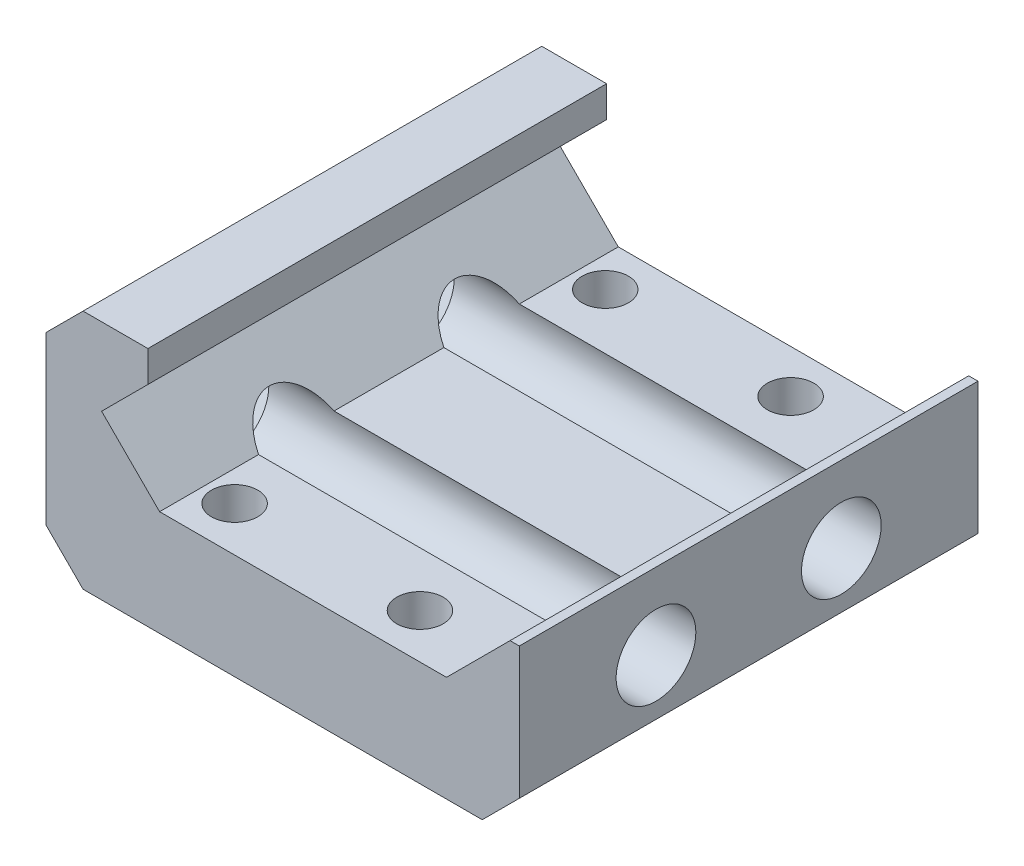
from build123d import *

# Parameters (mm, degrees)
DODANIE_WYCI_GNI_CIE3_DEPTH = 24.75
SZKIC3_R                    = 2.15
WYTNIJ_WYCI_GNI_CIE1_DEPTH  = 37.64214104
CUT_EXTRUDE1_DEPTH          = 35.618008319
CHAMFER1_SIZE               = 2
F_2_5_2_5_DIAMETER_HOLE1_D  = 2.5
CUT_EXTRUDE2_DEPTH          = 2.5


with BuildPart() as part:
    # Szkic1 → Dodanie-wyciągnięcie3 (new body)
    with BuildSketch(Plane.XY):
        Polygon((-3, 4.18), (2.5, 4.18), (2.5, 2.5), (0, 0), (3.13, -3.13), (18.61, -3.13), (22.54, 0.8), (22.54, -6.82), (20.54, -8.82), (-3, -8.82), align=None)
    extrude(amount=DODANIE_WYCI_GNI_CIE3_DEPTH)

    # Szkic3 → Wytnij-wyciągnięcie1 (cut, through all)
    with BuildSketch(Plane(origin=(22.54, 0, 0), x_dir=(0, 0, -1), z_dir=(1, 0, 0))):
        with Locations((-17.375, -3.82)):
            Circle(SZKIC3_R)
        with Locations((-7.375, -3.82)):
            Circle(SZKIC3_R)
    extrude(amount=-WYTNIJ_WYCI_GNI_CIE1_DEPTH, mode=Mode.SUBTRACT)

    # Sketch1 → Cut-Extrude1 (cut, through all)
    with BuildSketch(Plane.XY.offset(24.75)):
        Polygon((22.04, 0.3), (22.54, 0.3), (22.54, 0.8), align=None)
    extrude(amount=-CUT_EXTRUDE1_DEPTH, mode=Mode.SUBTRACT)

    # Chamfer1
    chamfer1_edges = [part.edges().sort_by_distance(p)[0] for p in [
        (-3, 4.18, 12.375),
        (-3, -8.82, 12.375),
    ]]
    chamfer(chamfer1_edges, length=CHAMFER1_SIZE)

    # Ø2.5 (2.5) Diameter Hole1 (through all)
    with Locations(Plane(origin=(0, -8.82, 0), x_dir=(-1, 0, 0), z_dir=(0, -1, 0))):
        with Locations((-4.77, -2.341796682), (-14.77, -2.341796682), (-14.77, -22.341796682), (-4.77, -22.341796682)):
            Hole(F_2_5_2_5_DIAMETER_HOLE1_D / 2)

    # Sketch6 → Cut-Extrude2 (cut)
    with BuildSketch(Plane.ZY.offset(3)):
        Polygon((9.366858429, -7.27), (11.358716857, -3.82), (9.366858429, -0.37), (5.383141571, -0.37), (3.391283143, -3.82), (5.383141571, -7.27), align=None)
        Polygon((15.383141571, -7.27), (19.366858429, -7.27), (21.358716857, -3.82), (19.366858429, -0.37), (15.383141571, -0.37), (13.391283143, -3.82), align=None)
    extrude(amount=-CUT_EXTRUDE2_DEPTH, mode=Mode.SUBTRACT)


solid = part.part
